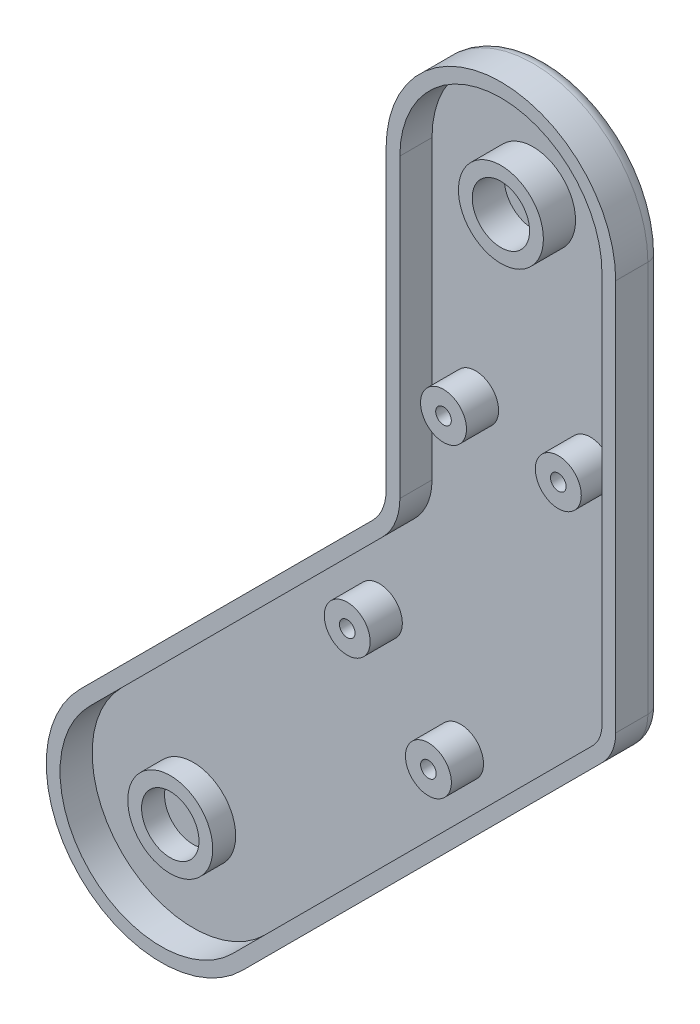
from build123d import *

# Parameters (mm, degrees)
BOSS_EXTRUDE1_DEPTH                          = 10
FILLET1_R                                    = 10
SHELL1_T                                     = -3
FILLET4_R                                    = 3
SKETCH2_R                                    = 9.25
BOSS_EXTRUDE2_DEPTH                          = 5
BOSS_EXTRUDE5_START                          = -3
SKETCH18_R                                   = 9.25
BOSS_EXTRUDE5_DEPTH                          = 10
SHELL2_START                                 = 3
SHELL2_OUTLINE_R                             = 6.25
SHELL2_DEPTH                                 = 7
SKETCH17_R                                   = 5
BOSS_EXTRUDE4_DEPTH                          = 10
CBORE_FOR_M5_HEX_HEAD_CAP_SCREW3_D           = 3.4
CBORE_FOR_M5_HEX_HEAD_CAP_SCREW3_CBORE_D     = 6.5
CBORE_FOR_M5_HEX_HEAD_CAP_SCREW3_CBORE_DEPTH = 3


# Read off the part's stored shape, not the designer's step: Shell2
with BuildPart() as part:
    # Sketch1 → Boss-Extrude1 (new body)
    with BuildSketch(Plane.XY):
        with BuildLine():
            Line((17.67766953, -17.67766953), (98.994949366, 63.639610307))
            Line((98.994949366, 63.639610307), (98.994949366, 153.051453663))
            ThreePointArc((98.994949366, 153.051453663), (73.994949366, 178.051453663), (48.994949366, 153.051453663))
            Line((48.994949366, 153.051453663), (48.994949366, 84.350288425))
            Line((48.994949366, 84.350288425), (-17.67766953, 17.67766953))
            ThreePointArc((-17.67766953, 17.67766953), (-17.67766953, -17.67766953), (17.67766953, -17.67766953))
        make_face()
    extrude(amount=BOSS_EXTRUDE1_DEPTH)

    # Fillet1
    fillet1_edges = [part.edges().sort_by_distance(p)[0] for p in [
        (48.994949366, 84.350288425, 5),
        (98.994949366, 63.639610307, 5),
    ]]
    fillet(fillet1_edges, radius=FILLET1_R)

    # Shell1
    shell1_openings = [part.faces().sort_by_distance(p)[0] for p in [
        (50.162308395, 71.072674162, 10),
    ]]
    offset(amount=SHELL1_T, openings=shell1_openings, kind=Kind.INTERSECTION)

    # Fillet4
    fillet4_edges = [part.edges().sort_by_distance(p)[0] for p in [
        (98.994949366, 110.416599797, 0),
        (14.194173824, 49.549512883, 0),
        (98.233744691, 63.954911607, 0),
        (48.233744691, 84.665589726, 0),
        (48.994949366, 120.771938856, 0),
        (73.994949366, 178.051453663, 0),
        (56.871843354, 21.516504294, 0),
        (-17.67766953, -17.67766953, 0),
    ]]
    fillet(fillet4_edges, radius=FILLET4_R)

    # Sketch2 → Boss-Extrude2 (add)
    with BuildSketch(Plane.XY.offset(3)):
        Circle(SKETCH2_R)
    extrude(amount=BOSS_EXTRUDE2_DEPTH)

    # Sketch18 → Boss-Extrude5 (add)
    with BuildSketch(Plane.XY.offset(3).offset(BOSS_EXTRUDE5_START)):
        with Locations((73.994949366, 153.051453663)):
            Circle(SKETCH18_R)
    extrude(amount=BOSS_EXTRUDE5_DEPTH)

    # Shell2 outline → Shell2 (cut)
    with BuildSketch(Plane.XY.offset(SHELL2_START)):
        with Locations((73.994949366, 153.051453663)):
            Circle(SHELL2_OUTLINE_R)
        Circle(SHELL2_OUTLINE_R)
    extrude(amount=SHELL2_DEPTH, mode=Mode.SUBTRACT)

    # Sketch17 → Boss-Extrude4 (add)
    with BuildSketch(Plane.XY):
        with Locations((40.533008589, 58.210678119)):
            Circle(SKETCH17_R)
        with Locations((61.494949366, 108.817279836)):
            Circle(SKETCH17_R)
        with Locations((86.494949366, 108.817279836)):
            Circle(SKETCH17_R)
        with Locations((58.210678119, 40.533008589)):
            Circle(SKETCH17_R)
    extrude(amount=BOSS_EXTRUDE4_DEPTH)

    # CBORE for M5 Hex Head Cap Screw3 (through all)
    with Locations(Plane(origin=(0, 0, 0), x_dir=(-1, 0, 0), z_dir=(0, 0, -1))):
        with Locations((-86.494949366, 108.817279836), (-61.494949366, 108.817279836), (-58.210678119, 40.533008589), (-40.533008589, 58.210678119)):
            CounterBoreHole(CBORE_FOR_M5_HEX_HEAD_CAP_SCREW3_D / 2, CBORE_FOR_M5_HEX_HEAD_CAP_SCREW3_CBORE_D / 2, CBORE_FOR_M5_HEX_HEAD_CAP_SCREW3_CBORE_DEPTH)


solid = part.part
